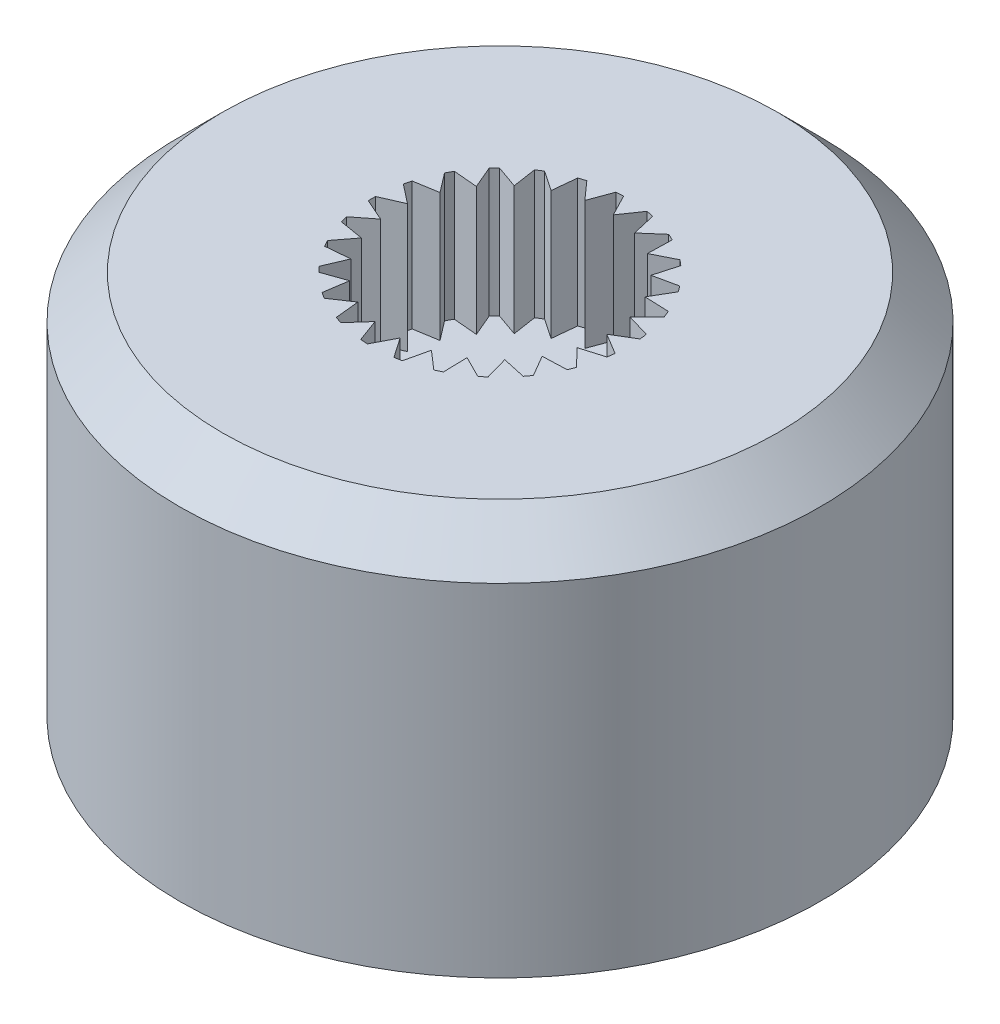
from build123d import *

# Parameters (mm, degrees)
SKETCH1_R                  = 7.5
BOSS_EXTRUDE1_DEPTH        = 6
M10X1_0_TAPPED_HOLE1_D     = 9
M10X1_0_TAPPED_HOLE1_DEPTH = 5
THREAD1_PITCH              = 1
THREAD1_TO                 = 6
SKETCH6_R                  = 7.5
SKETCH6_R_2                = 3
BOSS_EXTRUDE2_DEPTH        = 3
BOSS_EXTRUDE3_DEPTH        = 3
CIRPATTERN1_COUNT          = 25
CHAMFER1_SIZE              = 1


with BuildPart() as part:
    # Sketch1 → Boss-Extrude1 (new body)
    with BuildSketch(Plane(origin=(0, 0, 0), x_dir=(1, 0, 0), z_dir=(0, 1, 0))):
        with Locations(Location((0, 0, 0), (0, 0, 270))):
            Circle(SKETCH1_R)
    extrude(amount=BOSS_EXTRUDE1_DEPTH)

    # M10x1.0 Tapped Hole1
    with Locations(Plane(origin=(0, 0, 0), x_dir=(0, 0, -1), z_dir=(0, -1, 0))):
        with Locations((0, 0)):
            Hole(M10X1_0_TAPPED_HOLE1_D / 2, depth=M10X1_0_TAPPED_HOLE1_DEPTH)

    # Thread1: arcs per turn and ends read off the stored shape
    # Thread1: the profile of Thread Profile1 profile screwed along a right-hand helix through 6 turns, 8 arcs to a turn; built about Z, then put on its axis
    thread1_z = Axis((0, 0, 0), (0, 0, 1))
    thread1_corners = [(4.4997, 0, -0.000173205), (5.041265875, 0, 0.312499999), (5.041265875, 0, 0.437499999), (4.4997, 0, 0.750173202)]
    with BuildLine(mode=Mode.PRIVATE) as thread1_profile:
        Line(thread1_corners[0], thread1_corners[1])
        Line(thread1_corners[1], thread1_corners[2])
        Line(thread1_corners[2], thread1_corners[3])
        Line(thread1_corners[3], thread1_corners[0])
    thread1_cap = Face(thread1_profile.wire())
    thread1_turn_angles = [0, 22.5, 45, 67.5, 90, 112.5, 135, 157.5, 180, 202.5, 225, 247.5, 270, 292.5, 315, 337.5, 360]
    thread1_turn_weights = [1, 0.9238795325112867, 1, 0.9238795325112867, 1, 0.9238795325112867, 1, 0.9238795325112867, 1, 0.9238795325112867, 1, 0.9238795325112867, 1, 0.9238795325112867, 1, 0.9238795325112867, 1]
    thread1_turn_rails = [Edge.make_bspline([Vector(p[0], p[1], 0).rotate(thread1_z, thread1_turn_angles[k]) / thread1_turn_weights[k] + Vector(0, 0, p[2] + THREAD1_PITCH * thread1_turn_angles[k] / 360) for k in range(17)], [0, 0, 0, 1, 1, 2, 2, 3, 3, 4, 4, 5, 5, 6, 6, 7, 7, 8, 8, 8], 2, thread1_turn_weights) for p in thread1_corners]
    thread1_turn_sides = [Face.make_surface_from_curves(thread1_turn_rails[p[0]], thread1_turn_rails[p[1]]) for p in [(0, 1), (1, 2), (2, 3), (3, 0)]]
    thread1 = Plane(origin=(0, -1, 0), x_dir=(1, 0, 0), z_dir=(0, 1, 0)) * split(Solid(Shell([*[p.moved(Location((0, 0, THREAD1_PITCH * i))) for i in range(6) for p in thread1_turn_sides], thread1_cap, thread1_cap.rotate(thread1_z, 2160).moved(Location((0, 0, THREAD1_PITCH * 2160 / 360)))])), bisect_by=Plane.XY.offset(THREAD1_TO), keep=Keep.BOTTOM, mode=Mode.PRIVATE)
    add(thread1, mode=Mode.SUBTRACT)

    # Sketch6 → Boss-Extrude2 (add)
    with BuildSketch(Plane(origin=(0, 6, 0), x_dir=(1, 0, 0), z_dir=(0, 1, 0))):
        with Locations(Location((0, 0, 0), (0, 0, 270))):
            Circle(SKETCH6_R)
        with Locations(Location((0, 0, 0), (0, 0, 270))):
            Circle(SKETCH6_R_2, mode=Mode.SUBTRACT)
    extrude(amount=BOSS_EXTRUDE2_DEPTH)

    # Sketch7 → Boss-Extrude3 (add)
    with BuildSketch(Plane(origin=(0, 9, 0), x_dir=(1, 0, 0), z_dir=(0, 1, 0))):
        Polygon((3, 0.3), (3, -0.3), (2.5, 0), align=None)
    boss_extrude3 = extrude(amount=-BOSS_EXTRUDE3_DEPTH)

    # CirPattern1: Boss-Extrude3 ×25 about axis
    cirpattern1_axis = Axis((0, 0, 0), (0, 1, 0))
    for i in range(1, CIRPATTERN1_COUNT):
        add(boss_extrude3.rotate(cirpattern1_axis, i * 360 / CIRPATTERN1_COUNT))

    # Chamfer1
    chamfer1_edges = [part.edges().sort_by_distance(p)[0] for p in [
        (0, 9, -7.5),
    ]]
    chamfer(chamfer1_edges, length=CHAMFER1_SIZE)


solid = part.part
